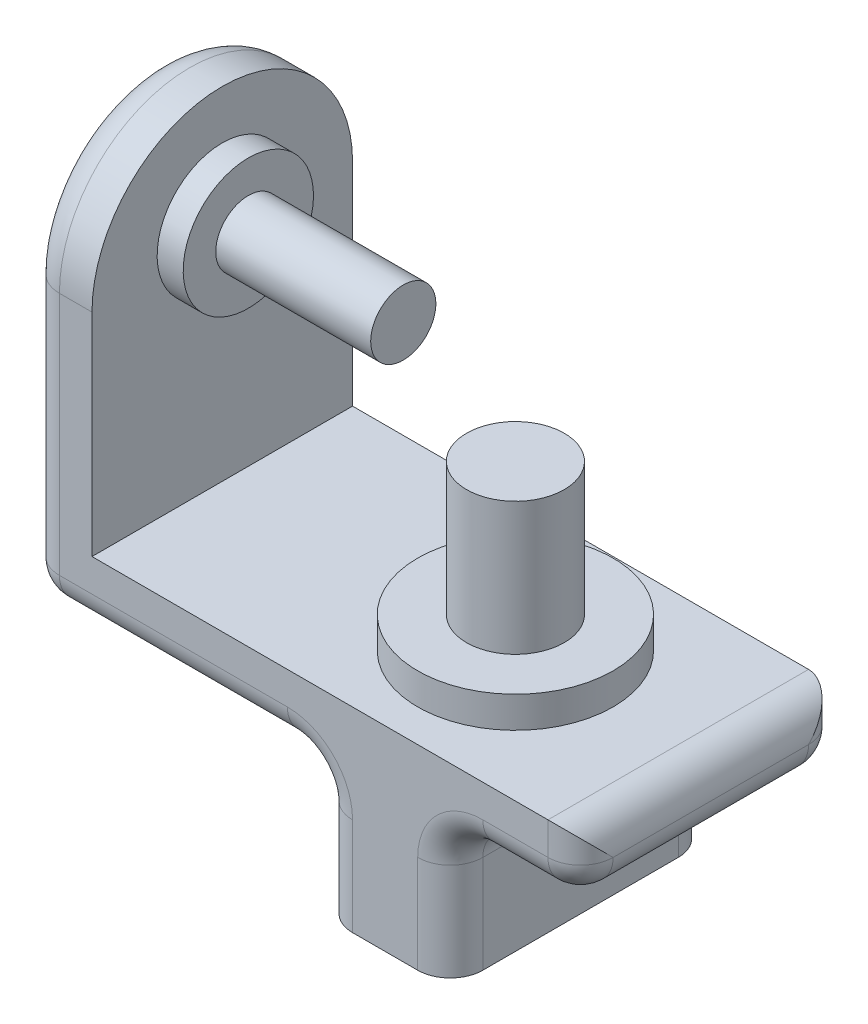
from build123d import *

# Parameters (mm, degrees)
SKETCH1_W           = 200
SKETCH1_H           = 200
BOSS_EXTRUDE1_DEPTH = 200
FILLET1_RADIUS      = 200
FILLET1_LENGTH      = 100
FILLET5_R           = 50
SKETCH2_R           = 150
SKETCH2_R_2         = 75
BOSS_EXTRUDE2_DEPTH = 48
SKETCH2_2_R         = 75
BOSS_EXTRUDE3_DEPTH = 251.487133837
SKETCH3_R           = 100
SKETCH3_R_2         = 50
BOSS_EXTRUDE4_DEPTH = 40
SKETCH3_4_R         = 50
BOSS_EXTRUDE5_DEPTH = 277.840021082
WRAP2_OUTLINE_W     = 3.419230769
WRAP2_OUTLINE_H     = 19.05
WRAP2_DEPTH         = 3
WRAP3_START         = -550.000101236
WRAP3_DEPTH         = 3


# Read off the part's stored shape, not the designer's step: Wrap2, Wrap3
with BuildPart() as part:
    # Sketch1 → Boss-Extrude1 (new, symmetric)
    with BuildSketch(Plane.XY):
        Polygon((-450.000101236, 475), (-450.000101236, -50), (299.999898764, -50), (299.999898764, -150), (-550.000101236, -150), (-550.000101236, 475), align=None)
        with Locations((0, -250)):
            Rectangle(SKETCH1_W, SKETCH1_H)
    extrude(amount=BOSS_EXTRUDE1_DEPTH, both=True)

    # Fillet1: full round fillet: the end face becomes a half cylinder, R = half its width
    fillet1_face = Plane((-500.000101236, 475, 0), x_dir=(1, 0, 0), z_dir=(0, 1, 0))  # on the end face: x along it, z out of the body
    fillet1_slab = fillet1_face.offset(-FILLET1_RADIUS / 2) * Box(FILLET1_LENGTH, 2 * FILLET1_RADIUS, FILLET1_RADIUS, mode=Mode.PRIVATE)  # the body's end, R deep
    fillet1_round = Plane((-500.000101236, 275, 0), x_dir=(0, 1, 0), z_dir=(1, 0, 0)) * Cylinder(FILLET1_RADIUS, FILLET1_LENGTH, mode=Mode.PRIVATE)  # its axis R under the face
    add(fillet1_slab - fillet1_round, mode=Mode.SUBTRACT)

    # Fillet5
    fillet5_edges = [part.edges().sort_by_distance(p)[0] for p in [
        (-100, -250, 200),
        (-550.000101236, -150, 0),
        (299.999898764, -150, 0),
        (299.999898764, -50, 0),
        (-550.000101236, 62.5, 200),
        (199.999949382, -150, 200),
        (-325.000050618, -150, 200),
        (299.999898764, -100, 200),
        (-550.000101236, 62.5, -200),
        (199.999949382, -150, -200),
        (-325.000050618, -150, -200),
        (299.999898764, -100, -200),
        (-550.000101236, 475, 0),
        (100, -250, 200),
        (-100, -250, -200),
        (100, -250, -200),
        (-100, -150, 0),
        (100, -150, 0),
    ]]
    fillet(fillet5_edges, radius=FILLET5_R - 0.0001)  # a hair under: the kernel refuses the full size

    # Sketch2 → Boss-Extrude2 (add)
    with BuildSketch(Plane(origin=(0, -50, 0), x_dir=(1, 0, 0), z_dir=(0, 1, 0))):
        with Locations(Location((0, 0, 0), (0, 0, 180))):
            Circle(SKETCH2_R)
        with Locations(Location((0, 0, 0), (0, 0, 180))):
            Circle(SKETCH2_R_2, mode=Mode.SUBTRACT)
    extrude(amount=BOSS_EXTRUDE2_DEPTH)

    # Sketch2<2> → Boss-Extrude3 (add)
    with BuildSketch(Plane(origin=(0, -50, 0), x_dir=(1, 0, 0), z_dir=(0, 1, 0))):
        Circle(SKETCH2_2_R)
    extrude(amount=BOSS_EXTRUDE3_DEPTH)

    # Sketch3 → Boss-Extrude4 (add)
    with BuildSketch(Plane(origin=(-450.000101236, 0, 0), x_dir=(0, 0, -1), z_dir=(1, 0, 0))):
        with Locations(Location((0, 300.000101172, 0), (0, 0, 90))):
            Circle(SKETCH3_R)
        with Locations(Location((0, 300.000101172, 0), (0, 0, 90))):
            Circle(SKETCH3_R_2, mode=Mode.SUBTRACT)
    extrude(amount=BOSS_EXTRUDE4_DEPTH)

    # Sketch3<4> → Boss-Extrude5 (add)
    with BuildSketch(Plane(origin=(-450.000101236, 0, 0), x_dir=(0, 0, -1), z_dir=(1, 0, 0))):
        with Locations(Location((0, 300.000101172, 0), (0, 0, 180))):
            Circle(SKETCH3_4_R)
    extrude(amount=BOSS_EXTRUDE5_DEPTH)

    # Wrap2 outline → Wrap2 (add)
    # profile 1 of 17: a face of its own
    with BuildSketch(Plane.ZY.offset(550.000101236)):
        with BuildLine():
            add(Edge.make_bspline(
                [(-82.804417139, 108.204415902), (-82.913939096, 108.358908009), (-83.124205981, 108.655511309), (-83.46502667, 109.05267012), (-83.804308379, 109.391476141), (-84.145194346, 109.670513999), (-84.490706056, 109.88808833), (-84.840243749, 110.042133359), (-85.1918258, 110.140061247), (-85.428034667, 110.152255625), (-85.544381081, 110.158262055)],
                knots=[0, 0, 0, 0, 0.162420307, 0.31182434, 0.448432767, 0.573381197, 0.689077147, 0.797572901, 0.900293043, 1, 1, 1, 1], degree=3))
            Line((-82.804417139, 108.204415902), (-80.247626274, 110.543688738))
            add(Edge.make_bspline(
                [(-85.506220024, 113.577492825), (-85.28176812, 113.569281896), (-84.834636057, 113.552924852), (-84.173538405, 113.425018117), (-83.527805859, 113.223871303), (-83.007462472, 112.981209802), (-82.593434952, 112.746143491), (-82.276121533, 112.529724042), (-81.95323805, 112.281803932), (-81.622180646, 112.001601899), (-81.289100883, 111.683838568), (-80.944527708, 111.336078546), (-80.593156353, 110.955316373), (-80.364820683, 110.683301642), (-80.247626274, 110.543688738)],
                knots=[0, 0, 0, 0, 0.10691022, 0.212976528, 0.319776676, 0.428556273, 0.485856803, 0.546558687, 0.611431498, 0.67982091, 0.753158505, 0.830752869, 0.913133075, 1, 1, 1, 1], degree=3))
            add(Edge.make_bspline(
                [(-90.505318581, 108.746302921), (-90.501186394, 108.909398801), (-90.493045542, 109.230715205), (-90.420427882, 109.70316416), (-90.311898022, 110.159037705), (-90.154281508, 110.596672605), (-89.949714303, 111.015520705), (-89.70127538, 111.417632443), (-89.405106952, 111.799306873), (-89.071345127, 112.160290973), (-88.703625049, 112.49018936), (-88.310669416, 112.781357742), (-87.89470239, 113.027282792), (-87.458268647, 113.231295478), (-86.99866379, 113.387454229), (-86.519273705, 113.498147335), (-86.019410796, 113.563984065), (-85.679414835, 113.572933805), (-85.506220024, 113.577492825)],
                knots=[0, 0, 0, 0, 0.06317288, 0.12445736, 0.184840915, 0.244566821, 0.304319173, 0.365199786, 0.427420983, 0.491261689, 0.555499002, 0.618604518, 0.680494764, 0.742473305, 0.804990665, 0.868251971, 0.932887217, 1, 1, 1, 1], degree=3))
            add(Edge.make_bspline(
                [(-85.704657524, 102.060485613), (-85.947131837, 102.265642133), (-86.412513435, 102.659399592), (-87.070156678, 103.240966963), (-87.662752124, 103.78449496), (-88.185181482, 104.296702776), (-88.644101312, 104.768131121), (-89.036403609, 105.202609116), (-89.357778753, 105.603488165), (-89.695956795, 106.078302572), (-90.017293549, 106.656896551), (-90.295019692, 107.353012183), (-90.475196692, 108.049039488), (-90.495383019, 108.516313884), (-90.505318581, 108.746302921)],
                knots=[0, 0, 0, 0, 0.112124581, 0.215201009, 0.309902452, 0.395959096, 0.473447494, 0.542140328, 0.602523333, 0.654726333, 0.747804055, 0.835278417, 0.918925243, 1, 1, 1, 1], degree=3))
            add(Edge.make_bspline(
                [(-83.178395504, 98.774818546), (-83.184668072, 98.883522), (-83.197410193, 99.104342662), (-83.291264731, 99.432667477), (-83.437988, 99.760842976), (-83.611571975, 100.0300214), (-83.788215404, 100.255397197), (-83.957126364, 100.45067513), (-84.162815232, 100.666423059), (-84.40476047, 100.902912379), (-84.679765351, 101.162224965), (-84.988061531, 101.444335425), (-85.333179327, 101.746758701), (-85.577109267, 101.952766449), (-85.704657524, 102.060485613)],
                knots=[0, 0, 0, 0, 0.076346606, 0.155090822, 0.238351561, 0.32840414, 0.37938386, 0.439617644, 0.509831416, 0.588874645, 0.677436354, 0.77554672, 0.882635872, 1, 1, 1, 1], degree=3))
            add(Edge.make_bspline(
                [(-85.353575793, 96.969800517), (-85.205317748, 96.975796453), (-84.917675547, 96.987429443), (-84.507103114, 97.094879864), (-84.130674762, 97.263584908), (-83.805292874, 97.50430374), (-83.529780007, 97.78212986), (-83.326435696, 98.091224121), (-83.198693429, 98.425656651), (-83.185187974, 98.657975485), (-83.178395504, 98.774818546)],
                knots=[0, 0, 0, 0, 0.141985893, 0.275473311, 0.404345843, 0.535429711, 0.661427401, 0.77786684, 0.888279749, 1, 1, 1, 1], degree=3))
            add(Edge.make_bspline(
                [(-88.475150312, 99.412108209), (-88.3641225, 99.219115306), (-88.151272695, 98.849131415), (-87.790578802, 98.352011166), (-87.421066322, 97.92630996), (-87.034192458, 97.579552096), (-86.634661452, 97.307100973), (-86.220543476, 97.112388499), (-85.791547579, 96.991861698), (-85.499335063, 96.977142592), (-85.353575793, 96.969800517)],
                knots=[0, 0, 0, 0, 0.160457921, 0.307611547, 0.442138888, 0.566229194, 0.681222208, 0.789558005, 0.895028892, 1, 1, 1, 1], degree=3))
            Line((-88.475150312, 99.412108209), (-91.482241658, 97.60709018))
            add(Edge.make_bspline(
                [(-85.479507283, 93.550569748), (-85.642435172, 93.553460197), (-85.965125831, 93.559184944), (-86.440723077, 93.605922741), (-86.899965981, 93.681352571), (-87.342337248, 93.789466051), (-87.769829838, 93.926460494), (-88.182461307, 94.093793957), (-88.577383123, 94.294060048), (-88.957583452, 94.523140498), (-89.321214052, 94.789133077), (-89.672872888, 95.086599652), (-90.00906695, 95.420115393), (-90.331410912, 95.788891547), (-90.637842325, 96.193972401), (-90.93839179, 96.629716454), (-91.219701984, 97.104210524), (-91.393479805, 97.437071952), (-91.482241658, 97.60709018)],
                knots=[0, 0, 0, 0, 0.063551482, 0.125868382, 0.18624025, 0.244976651, 0.303357688, 0.361230317, 0.418489049, 0.475936712, 0.534203744, 0.594059429, 0.655468694, 0.718771685, 0.784974607, 0.853522316, 0.925182451, 1, 1, 1, 1], degree=3))
            add(Edge.make_bspline(
                [(-79.759164735, 98.973256046), (-79.762574714, 98.780859638), (-79.769265218, 98.403370724), (-79.851211066, 97.850971929), (-79.968061036, 97.322302307), (-80.148731589, 96.823114532), (-80.368931788, 96.345214589), (-80.644984541, 95.896046638), (-80.969170648, 95.471064917), (-81.340737702, 95.077866494), (-81.751734985, 94.721066179), (-82.192568632, 94.403434111), (-82.667549336, 94.14118838), (-83.172618937, 93.925247726), (-83.707507081, 93.758927347), (-84.271576557, 93.636001086), (-84.865690147, 93.562222682), (-85.271953581, 93.554510025), (-85.479507283, 93.550569748)],
                knots=[0, 0, 0, 0, 0.065200875, 0.127926544, 0.18904691, 0.248543693, 0.307607127, 0.36724766, 0.426963056, 0.488617128, 0.550391855, 0.611330734, 0.672556085, 0.734024191, 0.797340621, 0.862249627, 0.929625466, 1, 1, 1, 1], degree=3))
            add(Edge.make_bspline(
                [(-81.728275312, 103.342697152), (-81.560093288, 103.160688182), (-81.236788375, 102.810803024), (-80.81660596, 102.268591067), (-80.470782241, 101.739281636), (-80.203246455, 101.212914918), (-80.001192668, 100.681896488), (-79.858742072, 100.133203148), (-79.773427462, 99.561101397), (-79.763955549, 99.170711791), (-79.759164735, 98.973256046)],
                knots=[0, 0, 0, 0, 0.150833097, 0.289954183, 0.417138648, 0.535255184, 0.648751095, 0.762405462, 0.879826701, 1, 1, 1, 1], degree=3))
            add(Edge.make_bspline(
                [(-84.182031322, 105.540774075), (-84.021784624, 105.402088641), (-83.717669685, 105.1388925), (-83.284974517, 104.765327838), (-82.90470753, 104.429240819), (-82.5713291, 104.135675392), (-82.28989292, 103.881551383), (-82.059215831, 103.665654082), (-81.876480502, 103.492186613), (-81.772606168, 103.387412156), (-81.728275312, 103.342697152)],
                knots=[0, 0, 0, 0, 0.192952702, 0.366184141, 0.520457298, 0.655012135, 0.770624226, 0.865677185, 0.942674527, 1, 1, 1, 1], degree=3))
            add(Edge.make_bspline(
                [(-86.769351033, 107.99834619), (-86.725540319, 107.943037227), (-86.62469384, 107.8157233), (-86.43240026, 107.614077884), (-86.190919909, 107.3670446), (-85.890960113, 107.083118197), (-85.54497303, 106.752087573), (-85.136921711, 106.386965666), (-84.678551652, 105.976445077), (-84.352752834, 105.690573404), (-84.182031322, 105.540774075)],
                knots=[0, 0, 0, 0, 0.059234189, 0.136349281, 0.233805212, 0.349411224, 0.48317915, 0.635966856, 0.809243356, 1, 1, 1, 1], degree=3))
            add(Edge.make_bspline(
                [(-87.086087812, 108.910395469), (-87.082722509, 108.831103994), (-87.075945257, 108.671421982), (-87.010486225, 108.437388107), (-86.911820772, 108.208709768), (-86.817541904, 108.069502381), (-86.769351033, 107.99834619)],
                knots=[0, 0, 0, 0, 0.241881375, 0.487115475, 0.73783784, 1, 1, 1, 1], degree=3))
            add(Edge.make_bspline(
                [(-85.544381081, 110.158262055), (-85.65290568, 110.154456105), (-85.862438166, 110.147107816), (-86.161142271, 110.074066366), (-86.426336029, 109.948007551), (-86.657760623, 109.783175044), (-86.841083045, 109.584590088), (-86.987451783, 109.37632553), (-87.069869682, 109.146448558), (-87.080717499, 108.98855978), (-87.086087812, 108.910395469)],
                knots=[0, 0, 0, 0, 0.148126258, 0.285992887, 0.416634394, 0.547379946, 0.671582838, 0.784400739, 0.893265576, 1, 1, 1, 1], degree=3))
        make_face()
    # profile 2 of 17: a face of its own
    with BuildSketch(Plane.ZY.offset(550.000101236)):
        with BuildLine():
            add(Edge.make_bspline(
                [(-54.202704399, 113.089031286), (-53.866816356, 113.086683314), (-53.217540973, 113.082144657), (-52.276869391, 113.031004906), (-51.402164523, 112.952355599), (-50.592862516, 112.844159224), (-49.85062257, 112.700985792), (-49.176401788, 112.521402782), (-48.567937325, 112.314104073), (-48.018557493, 112.070175077), (-47.517026547, 111.785778093), (-47.040806908, 111.468982685), (-46.590833621, 111.108183712), (-46.160792023, 110.710341704), (-45.756231892, 110.268178266), (-45.370415852, 109.789017224), (-45.012790432, 109.265910083), (-44.672545387, 108.711399303), (-44.364839019, 108.12313492), (-44.096446027, 107.506124118), (-43.87161159, 106.86433759), (-43.688921967, 106.19709136), (-43.543297253, 105.506600482), (-43.441406576, 104.79147161), (-43.378416744, 104.052366834), (-43.372026952, 103.551439237), (-43.36878012, 103.296903882)],
                knots=[0, 0, 0, 0, 0.060148162, 0.116267077, 0.168653955, 0.217398969, 0.262433523, 0.303932701, 0.342259967, 0.377441339, 0.411406099, 0.445398351, 0.479766387, 0.514584482, 0.550213651, 0.587000908, 0.624662987, 0.663615456, 0.703456428, 0.743450162, 0.784013386, 0.825132536, 0.867264663, 0.910306473, 0.954424205, 1, 1, 1, 1], degree=3))
            Line((-54.202704399, 113.089031286), (-58.511087812, 113.089031286))
            Line((-58.511087812, 113.089031286), (-58.511087812, 94.039031286))
            Line((-58.511087812, 94.039031286), (-54.137830601, 94.039031286))
            add(Edge.make_bspline(
                [(-43.36878012, 103.296903882), (-43.37728208, 102.937737928), (-43.394018685, 102.230698724), (-43.534998502, 101.193126837), (-43.763010601, 100.198510697), (-44.083616322, 99.254630579), (-44.481081591, 98.369891872), (-44.955898363, 97.559896574), (-45.501104718, 96.828992328), (-46.11034897, 96.180818439), (-46.770012113, 95.623704197), (-47.455535142, 95.146576619), (-48.173596298, 94.77032171), (-48.806308528, 94.531719832), (-49.354948967, 94.383330108), (-49.836649337, 94.295630351), (-50.383811808, 94.215204386), (-51.001538195, 94.153052929), (-51.687118665, 94.097629104), (-52.443285951, 94.067513954), (-53.267591801, 94.042492735), (-53.840150152, 94.040215336), (-54.137830601, 94.039031286)],
                knots=[0, 0, 0, 0, 0.065772947, 0.129477895, 0.191430088, 0.252445668, 0.311786958, 0.36881755, 0.424091518, 0.478492106, 0.531393744, 0.58200397, 0.631201271, 0.679503008, 0.705561374, 0.735221723, 0.769132486, 0.80685832, 0.848929771, 0.895116661, 0.945469804, 1, 1, 1, 1], degree=3))
        make_face()
        with BuildLine():
            add(Edge.make_bspline(
                [(-53.305919543, 97.458262055), (-53.093420408, 97.458651442), (-52.684713831, 97.459400362), (-52.094634048, 97.495072051), (-51.548959868, 97.530876591), (-51.049193405, 97.598834805), (-50.591697513, 97.674535472), (-50.182756987, 97.779883317), (-49.813941788, 97.890542304), (-49.489756921, 98.031424909), (-49.192829996, 98.189997658), (-48.91790958, 98.375784016), (-48.652534407, 98.58209276), (-48.40166588, 98.814991724), (-48.164354522, 99.071396888), (-47.942004416, 99.352629393), (-47.731647778, 99.657831191), (-47.538684063, 99.98861596), (-47.362352788, 100.341490538), (-47.205927188, 100.71303682), (-47.076227283, 101.106348987), (-46.968428663, 101.517745162), (-46.891394326, 101.950807017), (-46.827663104, 102.402326924), (-46.794807803, 102.874093766), (-46.790298618, 103.195099691), (-46.788010889, 103.357961575)],
                knots=[0, 0, 0, 0, 0.062614648, 0.120428813, 0.174199486, 0.223724664, 0.26902845, 0.310765001, 0.348115258, 0.382378114, 0.414753161, 0.447195432, 0.480044579, 0.513738641, 0.547962504, 0.582917814, 0.619315101, 0.657123545, 0.695686576, 0.735513716, 0.7758232, 0.817652262, 0.860742584, 0.905386927, 0.951998197, 1, 1, 1, 1], degree=3))
            Line((-53.305919543, 97.458262055), (-55.091857043, 97.458262055))
            Line((-55.091857043, 97.458262055), (-55.091857043, 109.669800517))
            Line((-55.091857043, 109.669800517), (-53.78674887, 109.669800517))
            add(Edge.make_bspline(
                [(-48.585396706, 108.143358209), (-48.72708622, 108.267370827), (-49.016471009, 108.520652555), (-49.524535601, 108.824148838), (-50.084396467, 109.090800071), (-50.708861548, 109.302224761), (-51.391895663, 109.469428419), (-52.137566979, 109.584744694), (-52.941882265, 109.658845709), (-53.499093154, 109.666070682), (-53.78674887, 109.669800517)],
                knots=[0, 0, 0, 0, 0.101663476, 0.207636138, 0.318744567, 0.436679942, 0.563506646, 0.698681208, 0.844446556, 1, 1, 1, 1], degree=3))
            add(Edge.make_bspline(
                [(-46.788010889, 103.357961575), (-46.792567268, 103.607532015), (-46.801451853, 104.094175036), (-46.88713287, 104.802981217), (-47.02660522, 105.470428422), (-47.225618827, 106.094039572), (-47.476481646, 106.675567345), (-47.790494942, 107.210084967), (-48.154144793, 107.706571598), (-48.441709172, 107.997826586), (-48.585396706, 108.143358209)],
                knots=[0, 0, 0, 0, 0.142276686, 0.277428514, 0.406477152, 0.530595072, 0.650142922, 0.766850697, 0.883502093, 1, 1, 1, 1], degree=3))
        make_face(mode=Mode.SUBTRACT)
    # profile 3 of 17: a face of its own
    with BuildSketch(Plane.ZY.offset(550.000101236)):
        with BuildLine():
            add(Edge.make_bspline(
                [(-28.806520504, 113.089031286), (-28.557181104, 113.08791519), (-28.076153136, 113.085762006), (-27.38247123, 113.059651792), (-26.742515707, 113.012860696), (-26.156433597, 112.955034302), (-25.62446588, 112.873963947), (-25.145946375, 112.781023132), (-24.720775777, 112.66779417), (-24.344159655, 112.533392962), (-24.006158851, 112.374939189), (-23.686301075, 112.206174609), (-23.391815148, 112.004760036), (-23.107837476, 111.792403076), (-22.850603552, 111.54881735), (-22.604065583, 111.290213843), (-22.378665127, 111.006336552), (-22.173357759, 110.700621734), (-21.987112342, 110.378717693), (-21.824395885, 110.040048959), (-21.692409408, 109.684079626), (-21.581689165, 109.313112408), (-21.492757588, 108.927163475), (-21.433561899, 108.523859206), (-21.393353209, 108.106015624), (-21.389805347, 107.821631019), (-21.388010889, 107.677793305)],
                knots=[0, 0, 0, 0, 0.070781161, 0.136551696, 0.197012482, 0.252922694, 0.303686532, 0.349719151, 0.391240471, 0.428478555, 0.463056565, 0.497150358, 0.531002334, 0.564226377, 0.59770067, 0.631421421, 0.665597347, 0.700451436, 0.735880684, 0.771092108, 0.806974845, 0.843534403, 0.880940196, 0.919294384, 0.95918024, 1, 1, 1, 1], degree=3))
            Line((-28.806520504, 113.089031286), (-32.622626274, 113.089031286))
            Line((-32.622626274, 113.089031286), (-32.622626274, 94.039031286))
            Line((-32.622626274, 94.039031286), (-29.203395504, 94.039031286))
            Line((-29.203395504, 94.039031286), (-29.203395504, 102.34287744))
            add(Edge.make_bspline(
                [(-25.322415937, 102.632901479), (-25.420072882, 102.608604273), (-25.631629273, 102.5559687), (-25.981696993, 102.502530383), (-26.385113284, 102.453397136), (-26.843182657, 102.411173059), (-27.356169197, 102.382470524), (-27.923576201, 102.360055122), (-28.545660809, 102.343756809), (-28.978233845, 102.343178474), (-29.203395504, 102.34287744)],
                knots=[0, 0, 0, 0, 0.077372749, 0.167614291, 0.272108317, 0.390015992, 0.52136331, 0.667272254, 0.826809521, 1, 1, 1, 1], degree=3))
            add(Edge.make_bspline(
                [(-21.388010889, 107.677793305), (-21.390607246, 107.518669068), (-21.395709405, 107.205970386), (-21.445727011, 106.747592483), (-21.531172884, 106.310570653), (-21.642846171, 105.891219414), (-21.798566627, 105.496438021), (-21.976469936, 105.116806872), (-22.195347436, 104.762969656), (-22.44544997, 104.430500298), (-22.718590471, 104.116695664), (-23.021253281, 103.83061627), (-23.347669517, 103.570311923), (-23.695949673, 103.333054611), (-24.067401297, 103.119322937), (-24.461756368, 102.92711553), (-24.881707767, 102.76257978), (-25.174149286, 102.676528914), (-25.322415937, 102.632901479)],
                knots=[0, 0, 0, 0, 0.068875425, 0.135348675, 0.199289315, 0.26155008, 0.322915384, 0.382771997, 0.442843572, 0.502652029, 0.562748843, 0.622739582, 0.682687332, 0.743329247, 0.805012514, 0.86806712, 0.933110571, 1, 1, 1, 1], degree=3))
        make_face()
        with BuildLine():
            add(Edge.make_bspline(
                [(-27.993689976, 105.762108209), (-27.773564956, 105.763503973), (-27.36853165, 105.766072198), (-26.815399184, 105.803210232), (-26.370891295, 105.859927512), (-26.019721808, 105.941273208), (-25.742440237, 106.064726072), (-25.503302241, 106.207537789), (-25.298187477, 106.388119284), (-25.120588281, 106.594464541), (-24.978603076, 106.831565583), (-24.880143732, 107.09556168), (-24.816186478, 107.380905992), (-24.810279432, 107.579486747), (-24.807241658, 107.681609411)],
                knots=[0, 0, 0, 0, 0.155159592, 0.285495954, 0.390502806, 0.470975045, 0.538445527, 0.60365534, 0.666587169, 0.73019895, 0.794944675, 0.860228437, 0.928120706, 1, 1, 1, 1], degree=3))
            Line((-27.993689976, 105.762108209), (-29.203395504, 105.762108209))
            Line((-29.203395504, 105.762108209), (-29.203395504, 109.669800517))
            Line((-29.203395504, 109.669800517), (-28.127253678, 109.669800517))
            add(Edge.make_bspline(
                [(-25.704026514, 109.292006046), (-25.764500976, 109.322589715), (-25.892537804, 109.387341611), (-26.110596935, 109.462620423), (-26.362233843, 109.526126395), (-26.64914736, 109.578835738), (-26.970192905, 109.619743662), (-27.3253132, 109.65102799), (-27.715030836, 109.663608637), (-27.986056133, 109.66767963), (-28.127253678, 109.669800517)],
                knots=[0, 0, 0, 0, 0.08210116, 0.173824981, 0.278953094, 0.396639095, 0.527315592, 0.671298143, 0.82875438, 1, 1, 1, 1], degree=3))
            add(Edge.make_bspline(
                [(-24.807241658, 107.681609411), (-24.810248184, 107.770832653), (-24.816081567, 107.943947194), (-24.858935184, 108.193794416), (-24.927231523, 108.426703568), (-25.026190293, 108.640242223), (-25.15412055, 108.834047543), (-25.310093423, 109.008043183), (-25.492107472, 109.165955406), (-25.63263296, 109.249540758), (-25.704026514, 109.292006046)],
                knots=[0, 0, 0, 0, 0.137787685, 0.267341238, 0.390444331, 0.511777883, 0.629508981, 0.747829066, 0.87188531, 1, 1, 1, 1], degree=3))
        make_face(mode=Mode.SUBTRACT)
    # profile 4 of 17: a face of its own
    with BuildSketch(Plane.ZY.offset(550.000101236)):
        with BuildLine():
            add(Edge.make_bspline(
                [(73.770402572, 113.089031286), (74.019741973, 113.08791519), (74.500769941, 113.085762006), (75.194451847, 113.059651792), (75.83440737, 113.012860696), (76.42048948, 112.955034302), (76.952457197, 112.873963947), (77.430976702, 112.781023132), (77.8561473, 112.66779417), (78.232763422, 112.533392962), (78.570764226, 112.374939189), (78.890622002, 112.206174609), (79.185107929, 112.004760036), (79.469085601, 111.792403076), (79.726319525, 111.54881735), (79.972857494, 111.290213843), (80.19825795, 111.006336552), (80.403565318, 110.700621734), (80.589810735, 110.378717693), (80.752527192, 110.040048959), (80.884513669, 109.684079626), (80.995233912, 109.313112408), (81.084165489, 108.927163475), (81.143361178, 108.523859206), (81.183569868, 108.106015624), (81.18711773, 107.821631019), (81.188912188, 107.677793305)],
                knots=[0, 0, 0, 0, 0.070781161, 0.136551696, 0.197012482, 0.252922694, 0.303686532, 0.349719151, 0.391240471, 0.428478555, 0.463056565, 0.497150358, 0.531002334, 0.564226377, 0.59770067, 0.631421421, 0.665597347, 0.700451436, 0.735880684, 0.771092108, 0.806974845, 0.843534403, 0.880940196, 0.919294384, 0.95918024, 1, 1, 1, 1], degree=3))
            Line((73.770402572, 113.089031286), (69.954296803, 113.089031286))
            Line((69.954296803, 113.089031286), (69.954296803, 94.039031286))
            Line((69.954296803, 94.039031286), (73.373527572, 94.039031286))
            Line((73.373527572, 94.039031286), (73.373527572, 102.34287744))
            add(Edge.make_bspline(
                [(77.25450714, 102.632901479), (77.156850195, 102.608604273), (76.945293804, 102.5559687), (76.595226084, 102.502530383), (76.191809793, 102.453397136), (75.73374042, 102.411173059), (75.22075388, 102.382470524), (74.653346875, 102.360055122), (74.031262268, 102.343756809), (73.598689232, 102.343178474), (73.373527572, 102.34287744)],
                knots=[0, 0, 0, 0, 0.077372749, 0.167614291, 0.272108317, 0.390015992, 0.52136331, 0.667272254, 0.826809521, 1, 1, 1, 1], degree=3))
            add(Edge.make_bspline(
                [(81.188912188, 107.677793305), (81.186315831, 107.518669068), (81.181213672, 107.205970386), (81.131196066, 106.747592483), (81.045750193, 106.310570653), (80.934076906, 105.891219414), (80.77835645, 105.496438021), (80.60045314, 105.116806872), (80.381575641, 104.762969656), (80.131473107, 104.430500298), (79.858332606, 104.116695664), (79.555669796, 103.83061627), (79.22925356, 103.570311923), (78.880973404, 103.333054611), (78.50952178, 103.119322937), (78.115166708, 102.92711553), (77.69521531, 102.76257978), (77.402773791, 102.676528914), (77.25450714, 102.632901479)],
                knots=[0, 0, 0, 0, 0.068875425, 0.135348675, 0.199289315, 0.26155008, 0.322915384, 0.382771997, 0.442843572, 0.502652029, 0.562748843, 0.622739582, 0.682687332, 0.743329247, 0.805012514, 0.86806712, 0.933110571, 1, 1, 1, 1], degree=3))
        make_face()
        with BuildLine():
            add(Edge.make_bspline(
                [(74.583233101, 105.762108209), (74.803358121, 105.763503973), (75.208391427, 105.766072198), (75.761523893, 105.803210232), (76.206031782, 105.859927512), (76.557201269, 105.941273208), (76.83448284, 106.064726072), (77.073620836, 106.207537789), (77.2787356, 106.388119284), (77.456334796, 106.594464541), (77.59832, 106.831565583), (77.696779345, 107.09556168), (77.760736599, 107.380905992), (77.766643645, 107.579486747), (77.769681419, 107.681609411)],
                knots=[0, 0, 0, 0, 0.155159592, 0.285495954, 0.390502806, 0.470975045, 0.538445527, 0.60365534, 0.666587169, 0.73019895, 0.794944675, 0.860228437, 0.928120706, 1, 1, 1, 1], degree=3))
            Line((74.583233101, 105.762108209), (73.373527572, 105.762108209))
            Line((73.373527572, 105.762108209), (73.373527572, 109.669800517))
            Line((73.373527572, 109.669800517), (74.449669399, 109.669800517))
            add(Edge.make_bspline(
                [(76.872896563, 109.292006046), (76.812422101, 109.322589715), (76.684385273, 109.387341611), (76.466326142, 109.462620423), (76.214689234, 109.526126395), (75.927775717, 109.578835738), (75.606730172, 109.619743662), (75.251609877, 109.65102799), (74.861892241, 109.663608637), (74.590866944, 109.66767963), (74.449669399, 109.669800517)],
                knots=[0, 0, 0, 0, 0.08210116, 0.173824981, 0.278953094, 0.396639095, 0.527315592, 0.671298143, 0.82875438, 1, 1, 1, 1], degree=3))
            add(Edge.make_bspline(
                [(77.769681419, 107.681609411), (77.766674893, 107.770832653), (77.76084151, 107.943947194), (77.717987893, 108.193794416), (77.649691554, 108.426703568), (77.550732784, 108.640242223), (77.422802526, 108.834047543), (77.266829654, 109.008043183), (77.084815605, 109.165955406), (76.944290117, 109.249540758), (76.872896563, 109.292006046)],
                knots=[0, 0, 0, 0, 0.137787685, 0.267341238, 0.390444331, 0.511777883, 0.629508981, 0.747829066, 0.87188531, 1, 1, 1, 1], degree=3))
        make_face(mode=Mode.SUBTRACT)
    # profile 5 of 17: a face of its own
    with BuildSketch(Plane.ZY.offset(550.000101236)):
        with BuildLine():
            add(Edge.make_bspline(
                [(119.121003534, 113.089031286), (119.384345675, 113.088096573), (119.890826791, 113.086298855), (120.621144896, 113.057935639), (121.292042512, 113.018465894), (121.904512961, 112.958234017), (122.45829422, 112.878373829), (122.953941306, 112.784231881), (123.391439732, 112.676936949), (123.774479193, 112.543238998), (124.120153366, 112.392429736), (124.442369753, 112.219147129), (124.748236927, 112.025320733), (125.035710496, 111.805850452), (125.307288673, 111.564684501), (125.563483806, 111.301580123), (125.800675621, 111.014306301), (126.017395417, 110.704678242), (126.214918066, 110.378956625), (126.38948666, 110.03669423), (126.531446131, 109.677653038), (126.656882541, 109.30702197), (126.747230324, 108.919502782), (126.810065885, 108.518868039), (126.856071625, 108.103707464), (126.858716735, 107.821665802), (126.860066034, 107.677793305)],
                knots=[0, 0, 0, 0, 0.072889027, 0.14018613, 0.202277434, 0.258895132, 0.310482942, 0.357095244, 0.398513567, 0.435037511, 0.469251486, 0.502805028, 0.536210446, 0.56937936, 0.602801475, 0.636665798, 0.670928657, 0.705803, 0.741189061, 0.776304311, 0.812004301, 0.847968976, 0.884521761, 0.921974159, 0.960198176, 1, 1, 1, 1], degree=3))
            Line((119.121003534, 113.089031286), (115.136989111, 113.089031286))
            Line((115.136989111, 113.089031286), (115.136989111, 94.039031286))
            Line((115.136989111, 94.039031286), (118.55621988, 94.039031286))
            Line((118.55621988, 94.039031286), (118.55621988, 102.34287744))
            Line((118.55621988, 102.34287744), (119.716316034, 102.34287744))
            Line((119.716316034, 102.34287744), (123.91403238, 94.039031286))
            Line((123.91403238, 94.039031286), (127.714873726, 94.039031286))
            Line((127.714873726, 94.039031286), (123.31871988, 102.732120229))
            add(Edge.make_bspline(
                [(126.860066034, 107.677793305), (126.85656104, 107.527623469), (126.849688385, 107.233167791), (126.812668528, 106.800636414), (126.745007859, 106.386820648), (126.642525931, 105.992932093), (126.524736267, 105.614068347), (126.368106228, 105.257219683), (126.191333749, 104.917196254), (125.981386239, 104.598807821), (125.750979105, 104.29498234), (125.483020454, 104.017360493), (125.194869891, 103.751021156), (124.870329424, 103.512646923), (124.523705099, 103.286119788), (124.148109854, 103.080825877), (123.745994952, 102.891604575), (123.463288263, 102.786081705), (123.31871988, 102.732120229)],
                knots=[0, 0, 0, 0, 0.068741263, 0.134789088, 0.19853605, 0.260385651, 0.320961578, 0.37990385, 0.438502936, 0.496154344, 0.554265483, 0.612748761, 0.672513443, 0.733646402, 0.796789619, 0.861935699, 0.929397735, 1, 1, 1, 1], degree=3))
        make_face()
        with BuildLine():
            add(Edge.make_bspline(
                [(119.888040794, 105.762108209), (120.050866971, 105.763942067), (120.362644114, 105.767453511), (120.811020594, 105.783741042), (121.218253371, 105.822985945), (121.586091238, 105.872570413), (121.916385123, 105.929822842), (122.206188921, 106.011869049), (122.459968065, 106.099783636), (122.674715264, 106.209038663), (122.858190336, 106.333285325), (123.016609318, 106.474432621), (123.14764453, 106.637792644), (123.255493194, 106.818925973), (123.339387729, 107.019434688), (123.400624312, 107.237117656), (123.434846506, 107.474454568), (123.438783886, 107.638249354), (123.440835265, 107.723586575)],
                knots=[0, 0, 0, 0, 0.105539996, 0.202086415, 0.290684899, 0.37055261, 0.442670262, 0.507674928, 0.565573203, 0.616454666, 0.663331357, 0.708862024, 0.7534118, 0.798515011, 0.845064321, 0.893873119, 0.944707806, 1, 1, 1, 1], degree=3))
            Line((119.888040794, 105.762108209), (118.55621988, 105.762108209))
            Line((118.55621988, 105.762108209), (118.55621988, 109.669800517))
            Line((118.55621988, 109.669800517), (119.72013214, 109.669800517))
            add(Edge.make_bspline(
                [(123.440835265, 107.723586575), (123.436956946, 107.824546737), (123.429338708, 108.022864266), (123.353742117, 108.30837197), (123.233408673, 108.572628883), (123.068464481, 108.814441029), (122.860738715, 109.026430248), (122.622357009, 109.213300434), (122.348174511, 109.361063394), (122.09430215, 109.458526269), (121.863337643, 109.516839313), (121.654899461, 109.560293677), (121.413526792, 109.591091032), (121.139037413, 109.62375711), (120.832131005, 109.644939407), (120.491134746, 109.660398262), (120.117027974, 109.666723239), (119.856240023, 109.668745223), (119.72013214, 109.669800517)],
                knots=[0, 0, 0, 0, 0.06376896, 0.125262305, 0.185413583, 0.246806762, 0.309422389, 0.372532682, 0.437733251, 0.505749517, 0.544013263, 0.588369599, 0.640389019, 0.697897401, 0.763271619, 0.834978604, 0.913873656, 1, 1, 1, 1], degree=3))
        make_face(mode=Mode.SUBTRACT)
    # profile 6 of 17: a face of its own
    with BuildSketch(Plane.ZY.offset(550.000101236)):
        Polygon((-128.727433966, 94.039031286), (-136.420703197, 113.089031286), (-139.591887091, 113.089031286), (-147.288972428, 94.039031286), (-143.640775312, 94.039031286), (-142.160126274, 97.946723594), (-133.860096226, 97.946723594), (-132.379447187, 94.039031286), align=None)
        Polygon((-135.153756081, 101.365954363), (-140.862650312, 101.365954363), (-138.008203197, 107.979265661), align=None, mode=Mode.SUBTRACT)
    # profile 7 of 17: a face of its own
    with BuildSketch(Plane.ZY.offset(550.000101236)):
        Polygon((-116.237319783, 94.039031286), (-112.119741658, 94.039031286), (-119.56878012, 104.663069748), (-112.779927956, 113.089031286), (-117.095943581, 113.089031286), (-122.499549351, 106.38413345), (-122.499549351, 113.089031286), (-125.91878012, 113.089031286), (-125.91878012, 94.039031286), (-122.499549351, 94.039031286), (-122.499549351, 102.972534892), align=None)
    # profile 8 of 17: a face of its own
    with BuildSketch(Plane.ZY.offset(550.000101236)):
        Polygon((-96.47752411, 94.039031286), (-92.825510889, 94.039031286), (-100.51878012, 113.089031286), (-103.689964014, 113.089031286), (-111.387049351, 94.039031286), (-107.738852235, 94.039031286), (-106.258203197, 97.946723594), (-97.958173149, 97.946723594), align=None)
        Polygon((-99.251833004, 101.365954363), (-104.960727235, 101.365954363), (-102.10628012, 107.979265661), align=None, mode=Mode.SUBTRACT)
    # profile 9 of 17: a face of its own
    with BuildSketch(Plane.ZY.offset(550.000101236)):
        Polygon((-66.326472428, 94.039031286), (-62.907241658, 94.039031286), (-62.907241658, 113.089031286), (-66.326472428, 113.089031286), (-66.326472428, 105.762108209), (-72.920703197, 105.762108209), (-72.920703197, 113.089031286), (-76.339933966, 113.089031286), (-76.339933966, 94.039031286), (-72.920703197, 94.039031286), (-72.920703197, 102.34287744), (-66.326472428, 102.34287744), align=None)
    # profile 10 of 17: a face of its own
    with BuildSketch(Plane.ZY.offset(550.000101236)):
        with Locations((-38.728395504, 103.564031286)):
            Rectangle(WRAP2_OUTLINE_W, WRAP2_OUTLINE_H)
    # profile 11 of 17: a face of its own
    with BuildSketch(Plane.ZY.offset(550.000101236)):
        Polygon((6.41231964, 94.039031286), (9.873527572, 94.039031286), (6.652734303, 113.089031286), (3.13810089, 113.089031286), (-1.238972428, 99.801350998), (-5.585516899, 113.089031286), (-9.134495264, 113.089031286), (-12.351472428, 94.039031286), (-8.886448389, 94.039031286), (-6.85628012, 106.071212777), (-2.918058966, 94.039031286), (0.417217476, 94.039031286), (4.378335265, 106.071212777), align=None)
    # profile 12 of 17: a face of its own
    with BuildSketch(Plane.ZY.offset(550.000101236)):
        Polygon((26.126322044, 94.039031286), (29.778335265, 94.039031286), (22.085066034, 113.089031286), (18.91388214, 113.089031286), (11.216796803, 94.039031286), (14.864993919, 94.039031286), (16.345642957, 97.946723594), (24.645673005, 97.946723594), align=None)
        Polygon((23.352013149, 101.365954363), (17.643118919, 101.365954363), (20.497566034, 107.979265661), align=None, mode=Mode.SUBTRACT)
    # profile 13 of 17: a face of its own
    with BuildSketch(Plane.ZY.offset(550.000101236)):
        Polygon((42.600450649, 94.039031286), (46.019681419, 94.039031286), (46.019681419, 113.089031286), (42.600450649, 113.089031286), (42.600450649, 105.762108209), (36.00621988, 105.762108209), (36.00621988, 113.089031286), (32.586989111, 113.089031286), (32.586989111, 94.039031286), (36.00621988, 94.039031286), (36.00621988, 102.34287744), (42.600450649, 102.34287744), align=None)
    # profile 14 of 17: a face of its own
    with BuildSketch(Plane.ZY.offset(550.000101236)):
        Polygon((63.493629736, 94.039031286), (67.145642957, 94.039031286), (59.452373726, 113.089031286), (56.281189832, 113.089031286), (48.584104496, 94.039031286), (52.232301611, 94.039031286), (53.712950649, 97.946723594), (62.012980697, 97.946723594), align=None)
        Polygon((60.719320842, 101.365954363), (55.010426611, 101.365954363), (57.864873726, 107.979265661), align=None, mode=Mode.SUBTRACT)
    # profile 15 of 17: a face of its own
    with BuildSketch(Plane.ZY.offset(550.000101236)):
        Polygon((97.685937428, 94.039031286), (101.337950649, 94.039031286), (93.644681419, 113.089031286), (90.473497524, 113.089031286), (82.776412188, 94.039031286), (86.424609303, 94.039031286), (87.905258342, 97.946723594), (96.20528839, 97.946723594), align=None)
        Polygon((94.911628534, 101.365954363), (89.202734303, 101.365954363), (92.057181419, 107.979265661), align=None, mode=Mode.SUBTRACT)
    # profile 16 of 17: a face of its own
    with BuildSketch(Plane.ZY.offset(550.000101236)):
        Polygon((105.611989111, 94.039031286), (109.03121988, 94.039031286), (109.03121988, 109.669800517), (112.450450649, 109.669800517), (112.450450649, 113.089031286), (102.192758342, 113.089031286), (102.192758342, 109.669800517), (105.611989111, 109.669800517), align=None)
    # profile 17 of 17: a face of its own
    with BuildSketch(Plane.ZY.offset(550.000101236)):
        Polygon((143.601322044, 94.039031286), (147.253335265, 94.039031286), (139.560066034, 113.089031286), (136.38888214, 113.089031286), (128.691796803, 94.039031286), (132.339993919, 94.039031286), (133.820642957, 97.946723594), (142.120673005, 97.946723594), align=None)
        Polygon((140.827013149, 101.365954363), (135.118118919, 101.365954363), (137.972566034, 107.979265661), align=None, mode=Mode.SUBTRACT)
    extrude(amount=WRAP2_DEPTH)

    # Wrap3 outline → Wrap3 (cut)
    with BuildSketch(Plane.YZ.offset(WRAP3_START)):
        with BuildLine():
            ThreePointArc((241.014166196, -50.807706324), (246.671020445, -48.464560573), (249.014166196, -42.807706324))
            Line((249.014166196, -42.807706324), (249.014166196, 42.807706324))
            ThreePointArc((249.014166196, 42.807706324), (246.671020445, 48.464560573), (241.014166196, 50.807706324))
            Line((241.014166196, 50.807706324), (195.001670098, 50.807706324))
            ThreePointArc((195.001670098, 50.807706324), (189.344815849, 48.464560574), (187.001670098, 42.807706324))
            Line((187.001670098, 42.807706324), (187.001670098, -42.807706324))
            ThreePointArc((187.001670098, -42.807706324), (189.344815849, -48.464560574), (195.001670098, -50.807706324))
            Line((195.001670098, -50.807706324), (241.014166196, -50.807706324))
        make_face()
        Polygon((202.69749029, -15.575007137), (218.007918147, 19.023749261), (233.664333033, -15.575007137), align=None, mode=Mode.SUBTRACT)
    extrude(amount=WRAP3_DEPTH, mode=Mode.SUBTRACT)


solid = part.part
